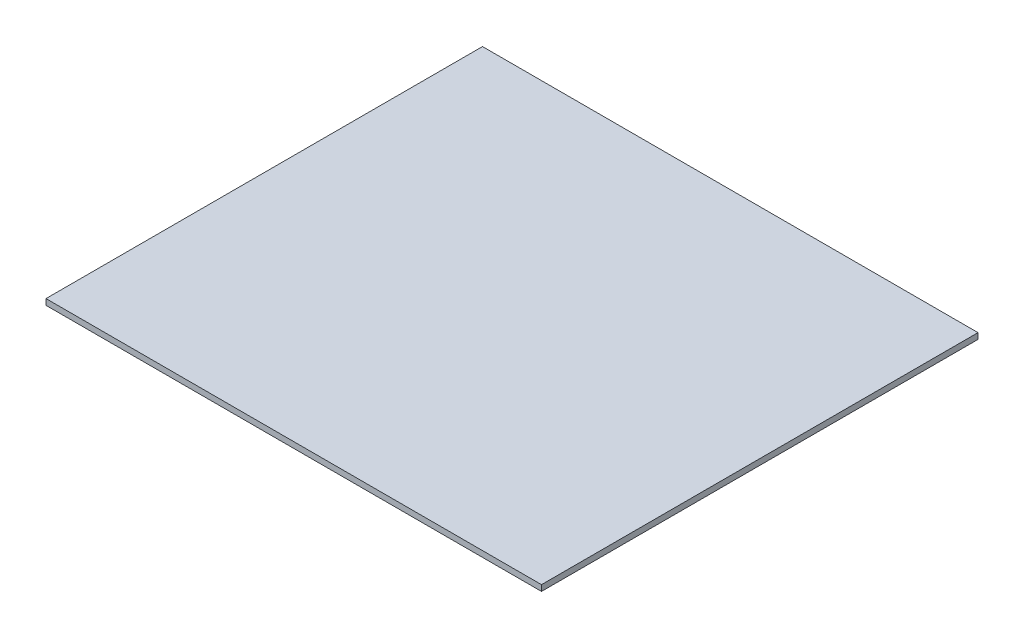
from build123d import *

# Parameters (mm, degrees)
SKETCH1_W           = 266.7
SKETCH1_H           = 234.95
BOSS_EXTRUDE1_DEPTH = 1.5875


with BuildPart() as part:
    # Sketch1 → Boss-Extrude1 (new, symmetric)
    with BuildSketch(Plane(origin=(0, 0, 0), x_dir=(1, 0, 0), z_dir=(0, 1, 0))):
        Rectangle(SKETCH1_W, SKETCH1_H)
    extrude(amount=BOSS_EXTRUDE1_DEPTH, both=True)


solid = part.part
